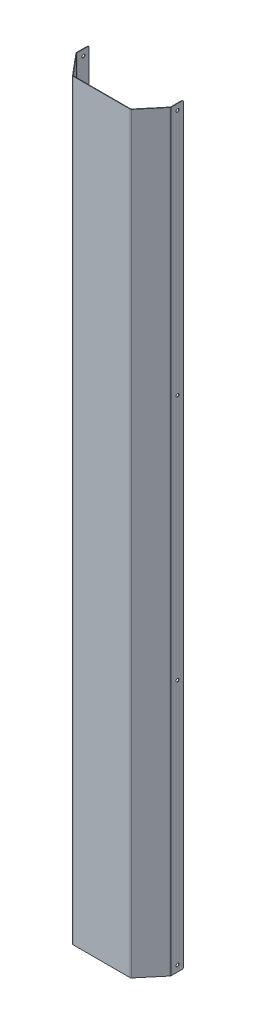
from build123d import *

# Parameters (mm, degrees)
BASE_FLANGE1_DEPTH = 1613
FILLET1_R          = 3
CUT_EXTRUDE4_REACH = 1629.362
SKETCH10_R         = 3.25
LPATTERN5_COUNT    = 4
LPATTERN5_PITCH    = 529


# Sheet-metal steps are written as plain solids
with BuildPart() as part:
    # Sketch1 → Base-Flange1 (new body)
    with BuildSketch(Plane(origin=(0, 0, 0), x_dir=(1, 0, 0), z_dir=(0, 1, 0))):
        with BuildLine():
            Line((-100.5, 73), (-100.5, 46.363970234))
            ThreePointArc((-100.5, 46.363970234), (-100.439692621, 46.021950091), (-100.266044443, 45.721182625))
            Line((-100.266044443, 45.721182625), (-62.201153751, 0.35721239))
            ThreePointArc((-62.201153751, 0.35721239), (-61.857727569, 0.093692213), (-61.435109308, 0))
            Line((-61.435109308, 0), (61.435109308, 0))
            ThreePointArc((61.435109308, 0), (61.857727569, 0.093692213), (62.201153751, 0.35721239))
            Line((62.201153751, 0.35721239), (100.266044443, 45.721182625))
            ThreePointArc((100.266044443, 45.721182625), (100.439692621, 46.021950091), (100.5, 46.363970234))
            Line((100.5, 46.363970234), (100.5, 73))
            Line((100.5, 73), (101.5, 73))
            Line((101.5, 73), (101.5, 46.363970234))
            ThreePointArc((101.5, 46.363970234), (101.379385242, 45.679929948), (101.032088886, 45.078395015))
            Line((101.032088886, 45.078395015), (62.967198194, -0.285575219))
            ThreePointArc((62.967198194, -0.285575219), (62.280345831, -0.812615574), (61.435109308, -1))
            Line((61.435109308, -1), (-61.435109308, -1))
            ThreePointArc((-61.435109308, -1), (-62.280345831, -0.812615574), (-62.967198194, -0.285575219))
            Line((-62.967198194, -0.285575219), (-101.032088886, 45.078395015))
            ThreePointArc((-101.032088886, 45.078395015), (-101.379385242, 45.679929948), (-101.5, 46.363970234))
            Line((-101.5, 46.363970234), (-101.5, 73))
            Line((-101.5, 73), (-100.5, 73))
        make_face()
    extrude(amount=BASE_FLANGE1_DEPTH)

    # Fillet1
    fillet1_edges = [part.edges().sort_by_distance(p)[0] for p in [
        (-101, 0, -73),
        (101, 0, -73),
        (-101, 1613, -73),
        (101, 1613, -73),
    ]]
    fillet(fillet1_edges, radius=FILLET1_R)

    # Cut-Extrude4: up to this face of the body (flat: up to its plane)
    cut_extrude4_end = Plane(part.part.faces().sort_by_distance((-101.5, 806.5, -59.680847857))[0])
    # Sketch10 → Cut-Extrude4 (cut, up to the picked face)
    with BuildSketch(Plane(origin=(101.5, 0, 0), x_dir=(0, 0, -1), z_dir=(1, 0, 0)), mode=Mode.PRIVATE) as cut_extrude4_sk1:
        with Locations((60.5, 13)):
            Circle(SKETCH10_R)
    cut_extrude4_tool1 = split(extrude(cut_extrude4_sk1.sketch, amount=-CUT_EXTRUDE4_REACH, mode=Mode.PRIVATE), bisect_by=cut_extrude4_end, keep=Keep.BOTH, mode=Mode.PRIVATE)
    cut_extrude4 = cut_extrude4_tool1.solids().sort_by(Axis((101.5, 13, -60.5), (-1, 0, 0)))[0]
    add(cut_extrude4, mode=Mode.SUBTRACT)

    # LPattern5: Cut-Extrude4 ×4
    with Locations(*[(0, i * LPATTERN5_PITCH, 0) for i in range(1, LPATTERN5_COUNT)]):
        add(cut_extrude4, mode=Mode.SUBTRACT)


solid = part.part
